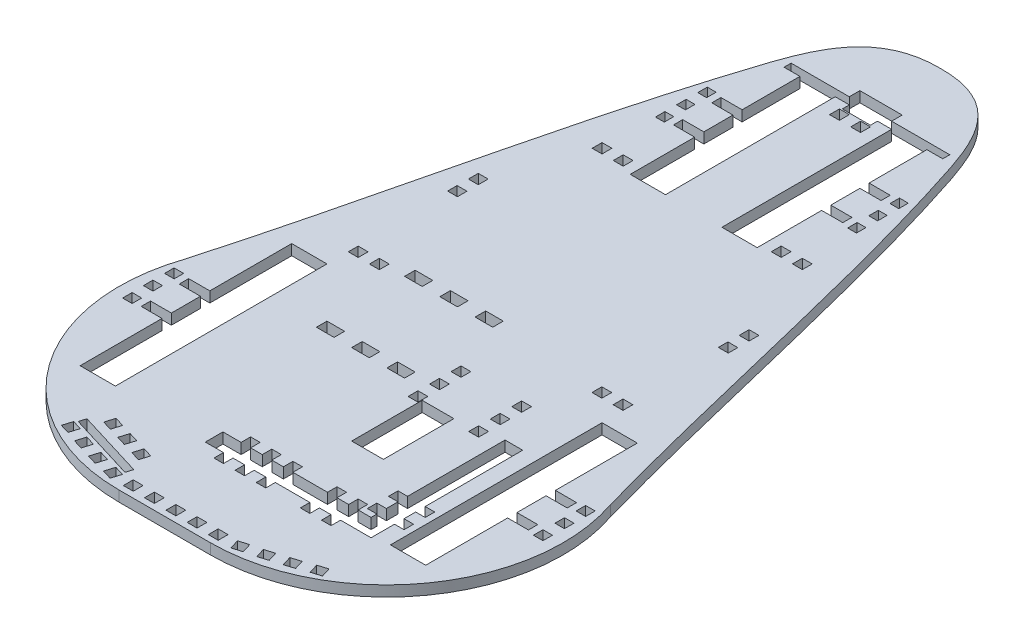
from build123d import *

# Parameters (mm, degrees)
SKETCH1_W           = 2.8
SKETCH1_H           = 2.8
SKETCH1_W_2         = 2.7
SKETCH1_H_2         = 2.7
SKETCH1_W_3         = 5
SKETCH1_H_3         = 3
SKETCH1_W_4         = 2.800000003
SKETCH1_H_4         = 2.800000033
SKETCH1_W_5         = 9
SKETCH1_H_5         = 20
SKETCH1_W_6         = 2.5
BOSS_EXTRUDE1_DEPTH = 3


with BuildPart() as part:
    # Sketch1 → Boss-Extrude1 (new body)
    with BuildSketch(Plane(origin=(0, 0, 0), x_dir=(1, 0, 0), z_dir=(0, 1, 0))):
        with BuildLine():
            ThreePointArc((-5.451969111, 56.808088935), (1.269226178, 11.627257287), (41.903464141, -9.237562859))
            Line((41.903464141, -9.237562859), (44.871962081, -9.237562859))
            Line((44.871962081, -9.237562859), (54.871962081, -9.237562859))
            Line((54.871962081, -9.237562859), (64.871962081, -9.237562859))
            Line((64.871962081, -9.237562859), (67.84046002, -9.237562859))
            ThreePointArc((67.84046002, -9.237562859), (108.474697984, 11.627257287), (115.195893273, 56.808088935))
            add(Edge.make_bspline(
                [(54.871962081, 210.762437141), (55.761906841, 210.762437141), (73.060865534, 210.353018757), (83.092198572, 181.760769201), (97.272207523, 130.317753231), (107.073405324, 85.55699407), (115.195893273, 56.808088935)],
                knots=[0, 0, 0, 0, 0.011071987, 0.221439749, 0.460221348, 1, 1, 1, 1], degree=3))
            add(Edge.make_bspline(
                [(54.871962081, 210.762437141), (53.982017321, 210.762437141), (36.683058627, 210.353018757), (26.65172559, 181.760769201), (12.471716639, 130.317753231), (2.670518837, 85.55699407), (-5.451969111, 56.808088935)],
                knots=[0, 0, 0, 0, 0.011071987, 0.221439749, 0.460221348, 1, 1, 1, 1], degree=3))
        make_face()
        Polygon((23.529030246, -3.480472375), (24.347671034, -0.802819063), (27.025324346, -1.621459851), (26.206683559, -4.299113163), align=None, mode=Mode.SUBTRACT)
        Polygon((17.852400316, -1.526070531), (18.671041104, 1.151582781), (21.348694416, 0.332941994), (20.530053629, -2.344711319), align=None, mode=Mode.SUBTRACT)
        Polygon((38.410831207, -4.05666693), (19.284736119, 1.790767266), (19.869479539, 3.703376775), (38.995574627, -2.144057422), align=None, mode=Mode.SUBTRACT)
        Polygon((23.067492085, 5.270815029), (23.886132872, 7.948468341), (26.563786185, 7.129827553), (25.745145397, 4.452174241), align=None, mode=Mode.SUBTRACT)
        Polygon((35.065885896, -6.788761308), (35.884526683, -4.111107996), (38.562179996, -4.929748783), (37.743539208, -7.607402096), align=None, mode=Mode.SUBTRACT)
        Polygon((29.266858773, -5.234702634), (30.08549956, -2.557049322), (32.763152873, -3.37569011), (31.944512085, -6.053343422), align=None, mode=Mode.SUBTRACT)
        with Locations((42.821962081, -6.13756323)):
            Rectangle(SKETCH1_W, SKETCH1_H, mode=Mode.SUBTRACT)
        Polygon((28.805320611, 3.51658477), (29.623961399, 6.194238082), (32.301614566, 5.375596822), (31.482973923, 2.697943982), align=None, mode=Mode.SUBTRACT)
        Polygon((34.543149138, 1.762354511), (35.361789925, 4.440007823), (38.039443237, 3.621367035), (37.22080245, 0.943713723), align=None, mode=Mode.SUBTRACT)
        with Locations((48.821962081, -6.13756323)):
            Rectangle(SKETCH1_W, SKETCH1_H, mode=Mode.SUBTRACT)
        with Locations((54.921962081, -6.137563566)):
            Rectangle(SKETCH1_W, SKETCH1_H, mode=Mode.SUBTRACT)
        with Locations((60.921962081, -6.13756323)):
            Rectangle(SKETCH1_W, SKETCH1_H, mode=Mode.SUBTRACT)
        with Locations((-3.378903903, 39.762437141)):
            Rectangle(SKETCH1_W_2, SKETCH1_H_2, mode=Mode.SUBTRACT)
        with Locations((66.921962081, -6.13756323)):
            Rectangle(SKETCH1_W, SKETCH1_H, mode=Mode.SUBTRACT)
        Polygon((72.000384954, -7.607402096), (71.181744166, -4.929748783), (73.859397479, -4.111107996), (74.678038266, -6.788761308), align=None, mode=Mode.SUBTRACT)
        Polygon((77.799412077, -6.053343422), (76.980771289, -3.37569011), (79.658424601, -2.557049322), (80.477065389, -5.234702634), align=None, mode=Mode.SUBTRACT)
        Polygon((82.718599816, -1.621459851), (85.396253128, -0.802819063), (86.214893915, -3.480472375), (83.537240603, -4.299113163), align=None, mode=Mode.SUBTRACT)
        Polygon((88.395229746, 0.332941994), (91.072883058, 1.151582781), (91.891523845, -1.526070531), (89.213870533, -2.344711319), align=None, mode=Mode.SUBTRACT)
        Polygon((80.721962081, 19.762437141), (84.371962081, 19.762437141), (84.371962081, 21.412437141), (81.671962081, 21.412437141), (81.671962081, 24.112437141), (84.371962081, 24.112437141), (84.371962081, 27.412437141), (81.671962081, 27.412437141), (81.671962081, 30.112437141), (84.371962081, 30.112437141), (84.371962081, 57.762437141), (89.371962081, 57.762437141), (89.371962081, 30.112437141), (92.071962081, 30.112437141), (92.071962081, 27.412437141), (89.371962081, 27.412437141), (89.371962081, 24.112437141), (92.071962081, 24.112437141), (92.071962081, 21.412437141), (89.371962081, 21.412437141), (89.371962081, 19.762437141), (89.371962081, 14.762437141), (84.371962081, 14.762437141), (80.721962081, 14.762437141), (80.721962081, 12.062437141), (78.021962081, 12.062437141), (78.021962081, 14.762437141), (74.721962081, 14.762437141), (74.721962081, 12.062437141), (72.021962081, 12.062437141), (72.021962081, 14.762437141), (62.221962161, 14.762437141), (62.221962081, 12.062437141), (59.521962081, 12.062437141), (59.521962161, 14.762437141), (56.221962161, 14.762437141), (56.221962081, 12.062437141), (53.521962081, 12.062437141), (53.521962081, 14.762437141), (50.221962081, 14.762437141), (50.221962081, 12.062437141), (47.521962081, 12.062437141), (47.521962081, 14.762437141), (42.371962081, 14.762437141), (42.371962081, 19.762437141), (47.521962081, 19.762437141), (47.521962081, 22.462437141), (50.221962081, 22.462437141), (50.221962081, 19.762437141), (53.521962081, 19.762437141), (53.521962081, 22.462437141), (56.221962081, 22.462437141), (56.221962161, 19.762437141), (59.521962161, 19.762437141), (59.521962081, 22.462437141), (62.221962081, 22.462437141), (62.221962161, 19.762437141), (72.021962081, 19.762437141), (72.021962081, 22.462437141), (74.721962081, 22.462437141), (74.721962081, 19.762437141), (78.021962081, 19.762437141), (78.021962081, 22.462437141), (80.721962081, 22.462437141), align=None, mode=Mode.SUBTRACT)
        with Locations((113.122828064, 39.762437141)):
            Rectangle(SKETCH1_W_2, SKETCH1_H_2, mode=Mode.SUBTRACT)
        with Locations((-3.478037919, 45.762437141)):
            Rectangle(SKETCH1_W_2, SKETCH1_H_2, mode=Mode.SUBTRACT)
        with Locations((-3.478037919, 51.762437141)):
            Rectangle(SKETCH1_W_2, SKETCH1_H_2, mode=Mode.SUBTRACT)
        Polygon((5.871962081, 52.537437141), (5.871962081, 75.762437141), (15.871962081, 75.762437141), (15.871962081, 15.762437141), (5.871962081, 15.762437141), (5.871962081, 38.987435764), (-0.028903903, 38.987435764), (-0.028903903, 41.637435764), (5.871962081, 41.637435764), (5.871962081, 49.887437141), (-0.128037919, 49.887437141), (-0.128037919, 52.537437141), align=None, mode=Mode.SUBTRACT)
        with Locations((61.321095984, 56.117167438)):
            Rectangle(SKETCH1_W, SKETCH1_H, mode=Mode.SUBTRACT)
        with Locations((32.421095947, 60.217167702)):
            Rectangle(SKETCH1_W_3, SKETCH1_H_3, mode=Mode.SUBTRACT)
        with Locations((42.421095947, 60.217167702)):
            Rectangle(SKETCH1_W_3, SKETCH1_H_3, mode=Mode.SUBTRACT)
        with Locations((52.421095947, 60.217167702)):
            Rectangle(SKETCH1_W_3, SKETCH1_H_3, mode=Mode.SUBTRACT)
        with Locations((61.321095986, 62.217167405)):
            Rectangle(SKETCH1_W_4, SKETCH1_H, mode=Mode.SUBTRACT)
        with Locations((61.321095986, 68.317167422)):
            Rectangle(SKETCH1_W_4, SKETCH1_H_4, mode=Mode.SUBTRACT)
        with Locations((17.32012911, 83.162436839)):
            Rectangle(SKETCH1_W, SKETCH1_H, mode=Mode.SUBTRACT)
        with Locations((23.32012911, 83.162436839)):
            Rectangle(SKETCH1_W, SKETCH1_H, mode=Mode.SUBTRACT)
        with Locations((32.421095947, 85.217167702)):
            Rectangle(SKETCH1_W_3, SKETCH1_H_3, mode=Mode.SUBTRACT)
        with Locations((42.421095947, 85.217167702)):
            Rectangle(SKETCH1_W_3, SKETCH1_H_3, mode=Mode.SUBTRACT)
        with Locations((52.421095947, 85.217167702)):
            Rectangle(SKETCH1_W_3, SKETCH1_H_3, mode=Mode.SUBTRACT)
        with Locations((67.371962081, 45.762437141)):
            Rectangle(SKETCH1_W_5, SKETCH1_H_5, mode=Mode.SUBTRACT)
        with Locations((78.521095987, 56.117167438)):
            Rectangle(SKETCH1_W, SKETCH1_H, mode=Mode.SUBTRACT)
        Polygon((103.871962081, 38.987435764), (103.871962081, 15.762437141), (93.871962081, 15.762437141), (93.871962081, 75.762437141), (103.871962081, 75.762437141), (103.871962081, 52.537437141), (109.871962081, 52.537437141), (109.871962081, 49.887437141), (103.871962081, 49.887437141), (103.871962081, 41.637435764), (109.772828064, 41.637435764), (109.772828064, 38.987435764), align=None, mode=Mode.SUBTRACT)
        with Locations((78.521095987, 62.217167405)):
            Rectangle(SKETCH1_W, SKETCH1_H, mode=Mode.SUBTRACT)
        with Locations((78.521095987, 68.317167422)):
            Rectangle(SKETCH1_W, SKETCH1_H_4, mode=Mode.SUBTRACT)
        with Locations((113.221962081, 45.762437141)):
            Rectangle(SKETCH1_W_2, SKETCH1_H_2, mode=Mode.SUBTRACT)
        with Locations((113.221962081, 51.762437141)):
            Rectangle(SKETCH1_W_2, SKETCH1_H_2, mode=Mode.SUBTRACT)
        with Locations((86.423795052, 83.162436839)):
            Rectangle(SKETCH1_W, SKETCH1_H, mode=Mode.SUBTRACT)
        with Locations((92.423795052, 83.162436839)):
            Rectangle(SKETCH1_W, SKETCH1_H, mode=Mode.SUBTRACT)
        with Locations((16.471962081, 112.112437141)):
            Rectangle(SKETCH1_W, SKETCH1_H_2, mode=Mode.SUBTRACT)
        with Locations((16.472928814, 118.062437141)):
            Rectangle(SKETCH1_W, SKETCH1_H, mode=Mode.SUBTRACT)
        with Locations((26.471962081, 143.162923344)):
            Rectangle(SKETCH1_W, SKETCH1_H, mode=Mode.SUBTRACT)
        with Locations((32.471962081, 143.162437141)):
            Rectangle(SKETCH1_W, SKETCH1_H, mode=Mode.SUBTRACT)
        with Locations((93.271962081, 112.112437141)):
            Rectangle(SKETCH1_W, SKETCH1_H_2, mode=Mode.SUBTRACT)
        with Locations((93.270995348, 118.062437141)):
            Rectangle(SKETCH1_W, SKETCH1_H, mode=Mode.SUBTRACT)
        with Locations((77.271962081, 143.162437141)):
            Rectangle(SKETCH1_W, SKETCH1_H, mode=Mode.SUBTRACT)
        with Locations((83.271962081, 143.162923344)):
            Rectangle(SKETCH1_W, SKETCH1_H, mode=Mode.SUBTRACT)
        with Locations((27.621962081, 159.762437141)):
            Rectangle(SKETCH1_W_6, SKETCH1_H_2, mode=Mode.SUBTRACT)
        with Locations((27.621962081, 165.762437141)):
            Rectangle(SKETCH1_W_6, SKETCH1_H_2, mode=Mode.SUBTRACT)
        with Locations((27.621962081, 171.762437141)):
            Rectangle(SKETCH1_W_6, SKETCH1_H_2, mode=Mode.SUBTRACT)
        Polygon((36.871962081, 172.487437141), (36.871962081, 188.883995744), (32.371962081, 188.883995744), (32.371962081, 190.883995744), (48.871962081, 190.883995744), (48.871962081, 193.883995744), (60.871962081, 193.883995744), (60.871962081, 190.883995744), (77.371962081, 190.883995744), (77.371962081, 188.883995744), (72.871962081, 188.883995744), (72.871962081, 172.487437141), (78.871962081, 172.487437141), (78.871962081, 169.887437141), (72.871962081, 169.887437141), (72.871962081, 161.637437141), (78.871962081, 161.637437141), (78.871962081, 159.037437141), (72.871962081, 159.037437141), (72.871962081, 140.762437141), (62.871962081, 140.762437141), (62.871962081, 188.883995744), (58.871962081, 188.883995744), (58.871962081, 186.883995744), (50.871962081, 186.883995744), (50.871962081, 188.883995744), (46.871962081, 188.883995744), (46.871962081, 140.762437141), (36.871962081, 140.762437141), (36.871962081, 159.037437141), (30.871962081, 159.037437141), (30.871962081, 161.637437141), (36.871962081, 161.637437141), (36.871962081, 169.887437141), (30.871962081, 169.887437141), (30.871962081, 172.487437141), align=None, mode=Mode.SUBTRACT)
        Polygon((50.471962081, 183.679368755), (50.473853269, 186.479368116), (53.271962081, 186.479368755), (53.271962081, 183.679368755), align=None, mode=Mode.SUBTRACT)
        Polygon((56.471962081, 183.679368755), (56.471962081, 186.479368755), (59.270070893, 186.479368116), (59.271962081, 183.679368755), align=None, mode=Mode.SUBTRACT)
        with Locations((82.121962081, 159.762437141)):
            Rectangle(SKETCH1_W_6, SKETCH1_H_2, mode=Mode.SUBTRACT)
        with Locations((82.121962081, 165.762437141)):
            Rectangle(SKETCH1_W_6, SKETCH1_H_2, mode=Mode.SUBTRACT)
        with Locations((82.121962081, 171.762437141)):
            Rectangle(SKETCH1_W_6, SKETCH1_H_2, mode=Mode.SUBTRACT)
    extrude(amount=BOSS_EXTRUDE1_DEPTH)


solid = part.part
